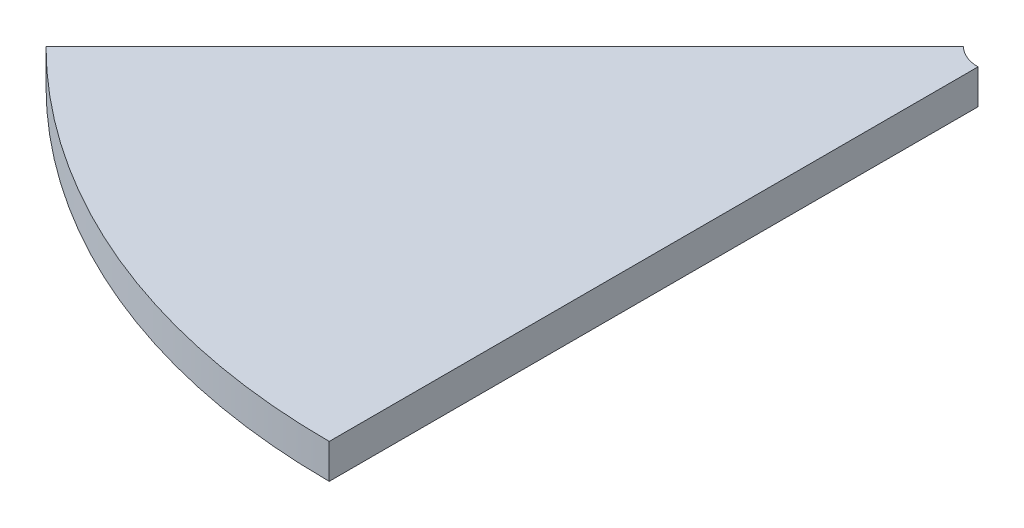
from build123d import *

# Parameters (mm, degrees)
BOSS_EXTRUDE1_DEPTH = 20


with BuildPart() as part:
    # Sketch1 → Boss-Extrude1 (new body)
    with BuildSketch(Plane(origin=(0, 0, 0), x_dir=(1, 0, 0), z_dir=(0, 1, 0))):
        with BuildLine():
            Line((-14.315742515, -14.315742515), (-279.48078546, -279.48078546))
            ThreePointArc((-279.48078546, -279.48078546), (-151.253911157, -365.159243676), (0, -395.24551722))
            Line((0, -395.24551722), (0, -20.24551722))
            ThreePointArc((0, -20.24551722), (-7.74762402, -18.704418984), (-14.315742515, -14.315742515))
        make_face()
    extrude(amount=BOSS_EXTRUDE1_DEPTH)


solid = part.part
